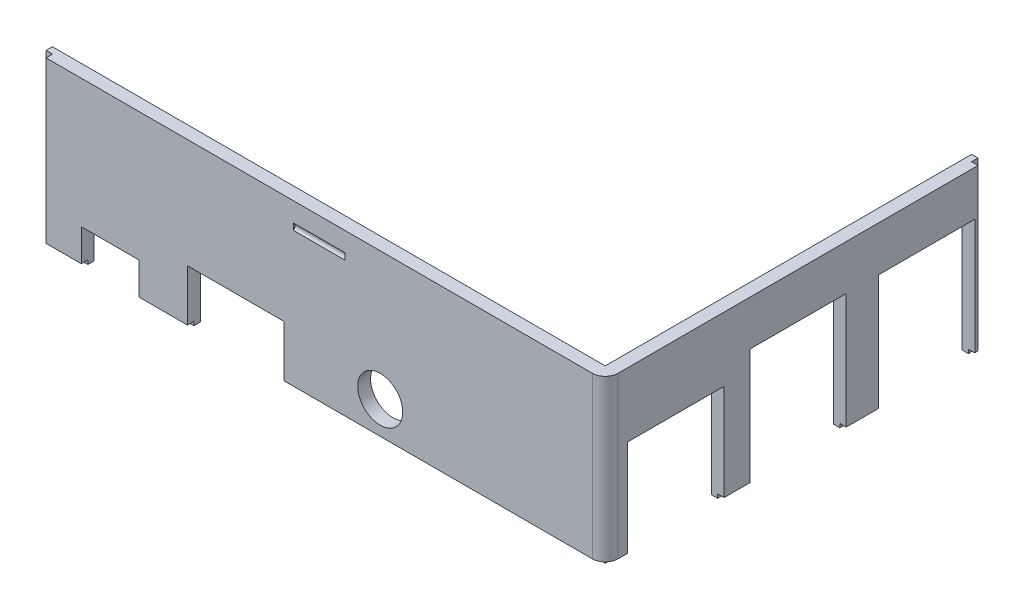
from build123d import *

# Parameters (mm, degrees)
P_IDAT_VYSUNUT_M1_DEPTH  = 25
SKICA2_W                 = 86
SKICA2_H                 = 1
P_IDAT_VYSUNUT_M2_DEPTH  = 0.6
ODEBRAT_VYSUNUT_M1_REACH = 110.858
SKICA5_R                 = 3.5
SKICA5_W                 = 9
SKICA5_H                 = 5.6
SKICA5_W_2               = 15
SKICA5_H_2               = 8.6
ODEBRAT_VYSUNUT_M2_REACH = 110.858
SKICA6_W                 = 15
SKICA6_H                 = 15.6
SKICA6_H_2               = 18.6
FILLET1_R                = 2
CUT_EXTRUDE1_START       = -40.5
CUT_EXTRUDE1_DEPTH       = 8


with BuildPart() as part:
    # Skica1 → Přidat vysunutím1 (new body)
    with BuildSketch(Plane(origin=(0, 0, 0), x_dir=(1, 0, 0), z_dir=(0, 1, 0))):
        Polygon((1, 1), (1, 0), (88, 0), (88, 58), (87, 58), (87, 59), (86, 59), (86, 2), (0, 2), (0, 1), align=None)
    extrude(amount=P_IDAT_VYSUNUT_M1_DEPTH)

    # Skica2 → Přidat vysunutím2 (add)
    with BuildSketch(Plane.XZ):
        with Locations((43, -1.5)):
            Rectangle(SKICA2_W, SKICA2_H)
        Polygon((87, -1), (86, -1), (86, -2), (86, -59), (87, -59), align=None)
    extrude(amount=P_IDAT_VYSUNUT_M2_DEPTH)

    # Skica5 → Odebrat vysunutím1 (cut, up to next)
    with BuildSketch(Plane.XY, mode=Mode.PRIVATE) as odebrat_vysunut_m1_sk1:
        with Locations((53, 5)):
            Circle(SKICA5_R)
    odebrat_vysunut_m1_tool1 = extrude(odebrat_vysunut_m1_sk1.sketch, amount=-ODEBRAT_VYSUNUT_M1_REACH, mode=Mode.PRIVATE) & part.part
    # Skica5 → Odebrat vysunutím1 (cut, up to next)
    with BuildSketch(Plane.XY, mode=Mode.PRIVATE) as odebrat_vysunut_m1_sk2:
        with Locations((11, 2.2)):
            Rectangle(SKICA5_W, SKICA5_H)
    odebrat_vysunut_m1_tool2 = extrude(odebrat_vysunut_m1_sk2.sketch, amount=-ODEBRAT_VYSUNUT_M1_REACH, mode=Mode.PRIVATE) & part.part
    # Skica5 → Odebrat vysunutím1 (cut, up to next)
    with BuildSketch(Plane.XY, mode=Mode.PRIVATE) as odebrat_vysunut_m1_sk3:
        with Locations((30.5, 3.7)):
            Rectangle(SKICA5_W_2, SKICA5_H_2)
    odebrat_vysunut_m1_tool3 = extrude(odebrat_vysunut_m1_sk3.sketch, amount=-ODEBRAT_VYSUNUT_M1_REACH, mode=Mode.PRIVATE) & part.part
    add(odebrat_vysunut_m1_tool1.solids().sort_by_distance((53, 5, 0))[0], mode=Mode.SUBTRACT)
    add(odebrat_vysunut_m1_tool2.solids().sort_by_distance((11, 2.2, 0))[0], mode=Mode.SUBTRACT)
    add(odebrat_vysunut_m1_tool3.solids().sort_by_distance((30.5, 3.7, 0))[0], mode=Mode.SUBTRACT)

    # Skica6 → Odebrat vysunutím2 (cut, up to next)
    with BuildSketch(Plane(origin=(88, 0, 0), x_dir=(0, 0, -1), z_dir=(1, 0, 0)), mode=Mode.PRIVATE) as odebrat_vysunut_m2_sk1:
        with Locations((11, 7.2)):
            Rectangle(SKICA6_W, SKICA6_H)
    odebrat_vysunut_m2_tool1 = extrude(odebrat_vysunut_m2_sk1.sketch, amount=-ODEBRAT_VYSUNUT_M2_REACH, mode=Mode.PRIVATE) & part.part
    # Skica6 → Odebrat vysunutím2 (cut, up to next)
    with BuildSketch(Plane(origin=(88, 0, 0), x_dir=(0, 0, -1), z_dir=(1, 0, 0)), mode=Mode.PRIVATE) as odebrat_vysunut_m2_sk2:
        with Locations((50, 8.7)):
            Rectangle(SKICA6_W, SKICA6_H_2)
    odebrat_vysunut_m2_tool2 = extrude(odebrat_vysunut_m2_sk2.sketch, amount=-ODEBRAT_VYSUNUT_M2_REACH, mode=Mode.PRIVATE) & part.part
    # Skica6 → Odebrat vysunutím2 (cut, up to next)
    with BuildSketch(Plane(origin=(88, 0, 0), x_dir=(0, 0, -1), z_dir=(1, 0, 0)), mode=Mode.PRIVATE) as odebrat_vysunut_m2_sk3:
        with Locations((30, 8.7)):
            Rectangle(SKICA6_W, SKICA6_H_2)
    odebrat_vysunut_m2_tool3 = extrude(odebrat_vysunut_m2_sk3.sketch, amount=-ODEBRAT_VYSUNUT_M2_REACH, mode=Mode.PRIVATE) & part.part
    add(odebrat_vysunut_m2_tool1.solids().sort_by_distance((88, 7.2, -11))[0], mode=Mode.SUBTRACT)
    add(odebrat_vysunut_m2_tool2.solids().sort_by_distance((88, 8.7, -50))[0], mode=Mode.SUBTRACT)
    add(odebrat_vysunut_m2_tool3.solids().sort_by_distance((88, 8.7, -30))[0], mode=Mode.SUBTRACT)

    # Fillet1
    fillet1_edges = [part.edges().sort_by_distance(p)[0] for p in [
        (88, 12.5, 0),
    ]]
    fillet(fillet1_edges, radius=FILLET1_R)

    # Sketch1 → Cut-Extrude1 (cut)
    with BuildSketch(Plane(origin=(88, 0, 0), x_dir=(0, 0, -1), z_dir=(1, 0, 0)).offset(CUT_EXTRUDE1_START)):
        with BuildLine():
            ThreePointArc((0, 21), (0.240312424, 21.5), (0, 22))
            Line((0, 22), (0, 21.5))
            Line((0, 21.5), (0, 21))
        make_face()
    extrude(amount=-CUT_EXTRUDE1_DEPTH, mode=Mode.SUBTRACT)


solid = part.part
